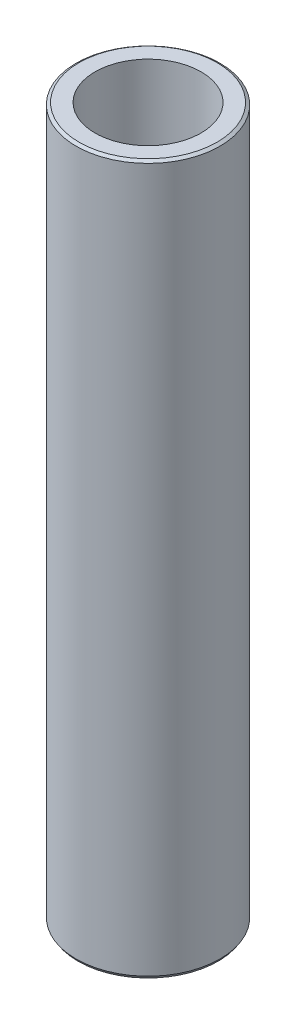
from build123d import *
from OCP.BRepFilletAPI import BRepFilletAPI_MakeChamfer

# Parameters (mm, degrees)
SKETCH1_R           = 55
BOSS_EXTRUDE1_DEPTH = 541.920394491
SKETCH2_R           = 40.551272195
CUT_EXTRUDE1_DEPTH  = 548.473939074
CHAMFER1_SIZE       = 1.495178556
CHAMFER1_SIZE2      = 2.272848398


with BuildPart() as part:
    # Sketch1 → Boss-Extrude1 (new body)
    with BuildSketch(Plane(origin=(0, 0, 0), x_dir=(1, 0, 0), z_dir=(0, 1, 0))):
        Circle(SKETCH1_R)
    extrude(amount=BOSS_EXTRUDE1_DEPTH)

    # Sketch2 → Cut-Extrude1 (cut, through all)
    with BuildSketch(Plane(origin=(0, 0, 0), x_dir=(1, 0, 0), z_dir=(0, 1, 0))):
        Circle(SKETCH2_R)
    extrude(amount=CUT_EXTRUDE1_DEPTH, mode=Mode.SUBTRACT)

    # Chamfer1: one chamfer whose edges measure the first distance from different faces: ONE call of the kernel's chamfer builder (chamfer() names one face for all edges)
    chamfer1_edges_1 = [part.edges().sort_by_distance(p)[0] for p in [
        (-55, 541.920394491, 0),
    ]]
    chamfer1_side_1 = [part.faces().sort_by_distance(p)[0] for p in [
        (-55, 270.960197245, 0),
    ]]
    chamfer1_edges_2 = [part.edges().sort_by_distance(p)[0] for p in [
        (-55, 0, 0),
    ]]
    chamfer1_side_2 = [part.faces().sort_by_distance(p)[0] for p in [
        (-53.444365081, 0, 0),
    ]]
    chamfer1 = BRepFilletAPI_MakeChamfer(part.part.solid().wrapped)
    for e in chamfer1_edges_1:
        chamfer1.Add(CHAMFER1_SIZE, CHAMFER1_SIZE2, e.wrapped, chamfer1_side_1[0].wrapped)  # the first distance lies on this face
    for e in chamfer1_edges_2:
        chamfer1.Add(CHAMFER1_SIZE, CHAMFER1_SIZE2, e.wrapped, chamfer1_side_2[0].wrapped)  # the first distance lies on this face
    add(Compound.cast(chamfer1.Shape()), mode=Mode.REPLACE)


solid = part.part
